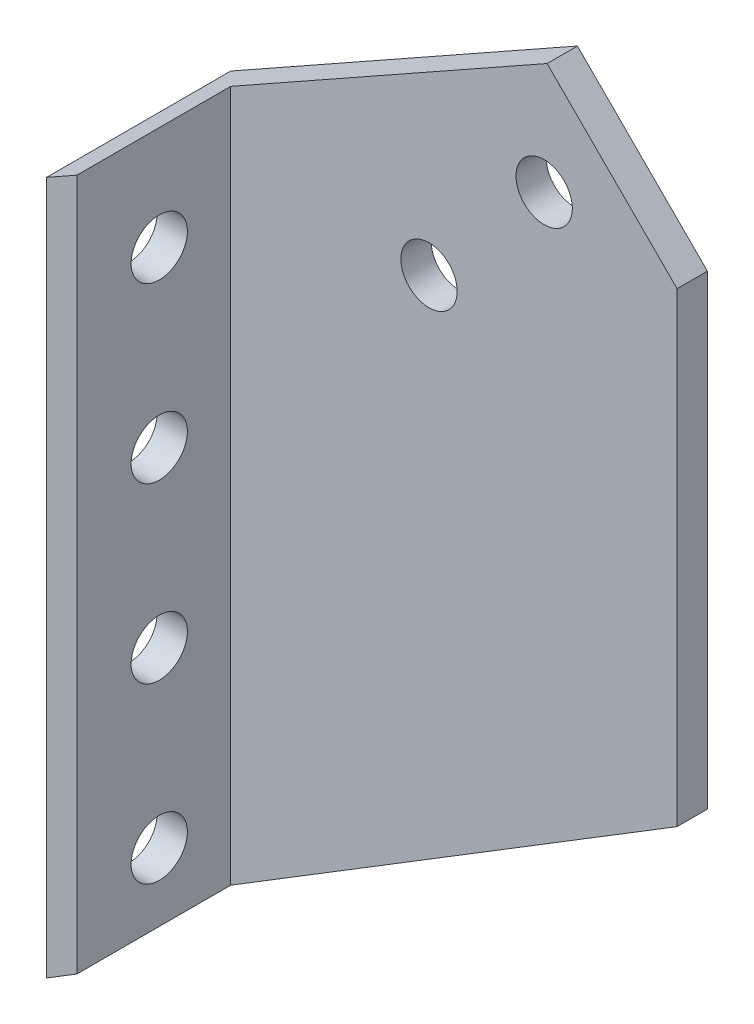
from build123d import *

# Parameters (mm, degrees)
SKETCH_1_R             = 13
EXTRUDE_1_DEPTH        = 14
EXTRUDE_2_DEPTH        = 71
SKETCH_5_R             = 13
CUT_EXTRUDE_3_DEPTH    = 420.252591423
PATTERN_LINEAR_1_COUNT = 4
PATTERN_LINEAR_1_PITCH = 80


with BuildPart() as part:
    # 草图1 → 凸台-拉伸1 (new body)
    with BuildSketch(Plane.XY):
        Polygon((-119.656440364, -63.376666372), (-119.656440364, 256.623333628), (40.343559636, 346.623333628), (100.343559636, 286.623333628), (100.343559636, 71.623333628), align=None)
        with Locations((-14.156440364, 234.748333628)):
            Circle(SKETCH_1_R, mode=Mode.SUBTRACT)
        with Locations((38.992666743, 294.541079122)):
            Circle(SKETCH_1_R, mode=Mode.SUBTRACT)
    extrude(amount=EXTRUDE_1_DEPTH)

    # 草图3 → 凸台-拉伸2 (add)
    with BuildSketch(Plane.XY.offset(14)):
        Polygon((-105.656440364, 264.498333628), (-105.656440364, -54.785757281), (-119.656440364, -63.376666372), (-119.656440364, 256.623333628), align=None)
    extrude(amount=EXTRUDE_2_DEPTH)

    # 草图5 → 切除-拉伸3 (cut, through all)
    with BuildSketch(Plane.ZY.offset(119.656440364)):
        with Locations((47, 216.623333628)):
            Circle(SKETCH_5_R)
    cut_extrude_3 = extrude(amount=-CUT_EXTRUDE_3_DEPTH, mode=Mode.SUBTRACT)

    # 阵列(线性)1: 切除-拉伸3 ×4
    with Locations(*[(0, -i * PATTERN_LINEAR_1_PITCH, 0) for i in range(1, PATTERN_LINEAR_1_COUNT)]):
        add(cut_extrude_3, mode=Mode.SUBTRACT)


solid = part.part
